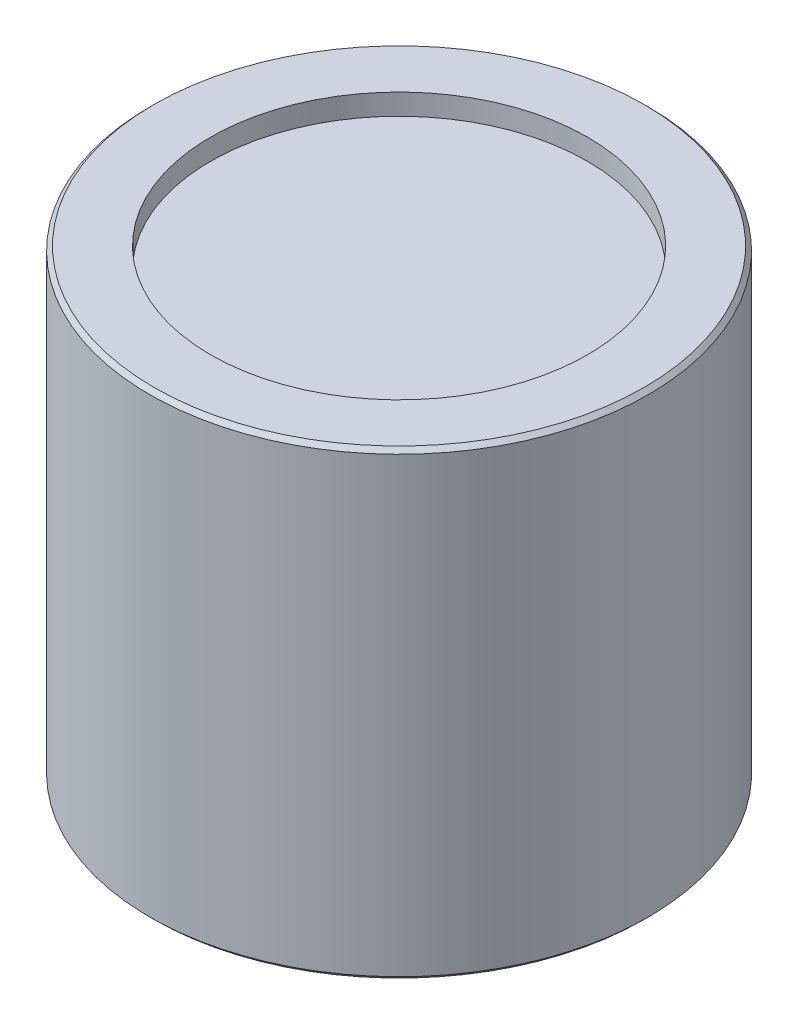
from build123d import *

# Parameters (mm, degrees)
PAH1_SIZE             = 1
KES_EKSTR_ZYON1_START = -5
IZIM2_R               = 45
KES_EKSTR_ZYON1_DEPTH = 5


with BuildPart() as part:
    # Çizim1 → Döndür1 (revolve)
    with BuildSketch(Plane(origin=(0, 0, 0), x_dir=(0, 0, -1), z_dir=(1, 0, 0))):
        Polygon((-45, 0), (0, 0), (0, 117), (-59.5, 117), (-59.5, 7), (-45, 7), align=None)
    revolve(axis=Axis((0, 7, 0), (0, 1, 0)))

    # Pah1
    pah1_edges = [part.edges().sort_by_distance(p)[0] for p in [
        (0, 7, -59.5),
        (0, 117, -59.5),
    ]]
    chamfer(pah1_edges, length=PAH1_SIZE)

    # Çizim2 → Kes-Ekstrüzyon1 (cut)
    with BuildSketch(Plane(origin=(0, 117, 0), x_dir=(1, 0, 0), z_dir=(0, 1, 0)).offset(KES_EKSTR_ZYON1_START)):
        Circle(IZIM2_R)
    extrude(amount=KES_EKSTR_ZYON1_DEPTH, mode=Mode.SUBTRACT)


solid = part.part
